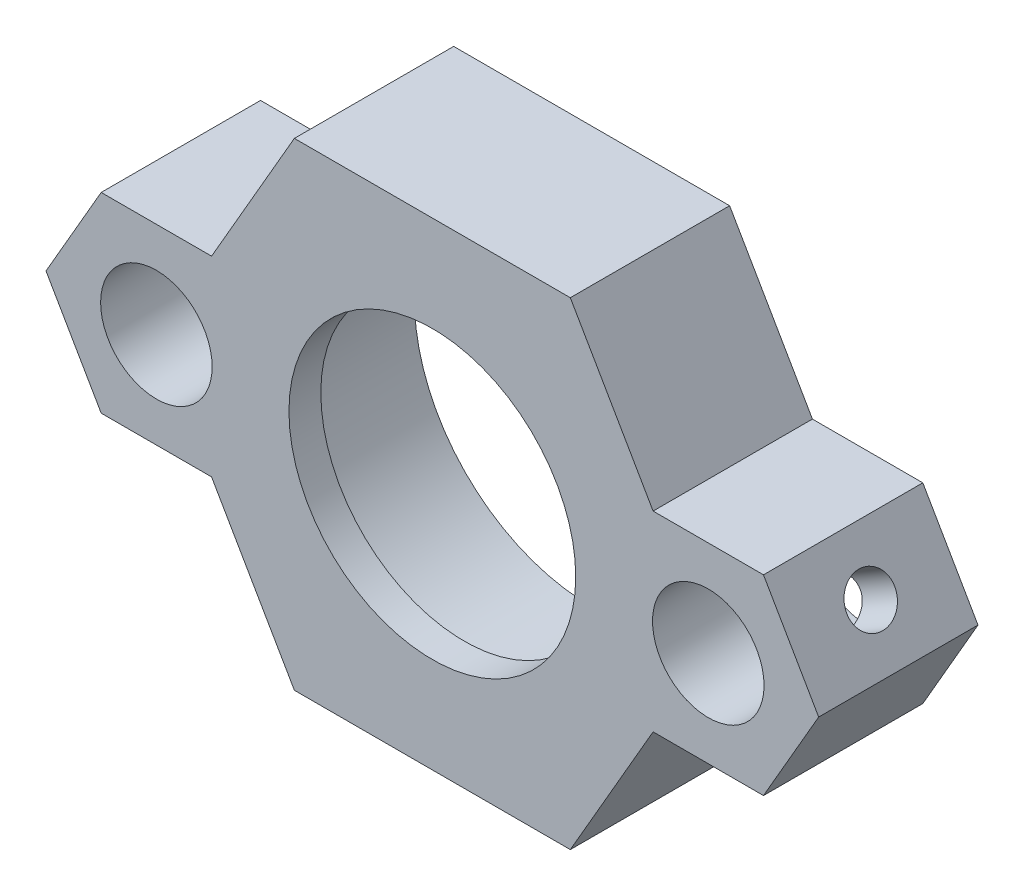
from build123d import *

# Parameters (mm, degrees)
SKETCH3_R               = 11.125
SKETCH3_R_2             = 3.5
BOSS_EXTRUDE1_DEPTH     = 8
SKETCH4_R               = 9
SKETCH4_R_2             = 3.5
BOSS_EXTRUDE3_DEPTH     = 2
CUT_EXTRUDE1_REACH      = 52.507
CUT_EXTRUDE1_END_RADIUS = 3.5
SKETCH5_R               = 1.5
CUT_EXTRUDE2_REACH      = 52.507
CUT_EXTRUDE2_END_RADIUS = 3.5
SKETCH6_R               = 1.5


with BuildPart() as part:
    # Sketch3 → Boss-Extrude1 (new body)
    with BuildSketch(Plane.XY):
        Polygon((8.660254038, 15), (-8.660254038, 15), (-13.856406461, 6), (-20.784609691, 6), (-24.248711306, 0), (-20.784609691, -6), (-13.856406461, -6), (-8.660254038, -15), (8.660254038, -15), (13.856406461, -6), (20.784609691, -6), (24.248711306, 0), (20.784609691, 6), (13.856406461, 6), align=None)
        Circle(SKETCH3_R, mode=Mode.SUBTRACT)
        with Locations((17.320508076, 0)):
            Circle(SKETCH3_R_2, mode=Mode.SUBTRACT)
        with Locations((-17.320508076, 0)):
            Circle(SKETCH3_R_2, mode=Mode.SUBTRACT)
    extrude(amount=BOSS_EXTRUDE1_DEPTH)

    # Sketch4 → Boss-Extrude3 (add)
    with BuildSketch(Plane.XY.offset(8)):
        Polygon((-8.660254038, 15), (-13.856406461, 6), (-20.784609691, 6), (-24.248711306, 0), (-20.784609691, -6), (-13.856406461, -6), (-8.660254038, -15), (8.660254038, -15), (13.856406461, -6), (20.784609691, -6), (24.248711306, 0), (20.784609691, 6), (13.856406461, 6), (8.660254038, 15), align=None)
        Circle(SKETCH4_R, mode=Mode.SUBTRACT)
        with Locations((-17.320508076, 0)):
            Circle(SKETCH4_R_2, mode=Mode.SUBTRACT)
        with Locations((17.320508076, 0)):
            Circle(SKETCH4_R_2, mode=Mode.SUBTRACT)
    extrude(amount=BOSS_EXTRUDE3_DEPTH)

    # Cut-Extrude1: up to this cylinder (the profile starts outside it)
    cut_extrude1_end = Plane(origin=(-17.320508076, 0, 5), z_dir=(0, 0, -1)) * Cylinder(CUT_EXTRUDE1_END_RADIUS, 113.014, mode=Mode.PRIVATE)
    # Sketch5 → Cut-Extrude1 (cut, up to the surface)
    with BuildSketch(Plane(origin=(-18.186533479, 10.5, 0), x_dir=(0, 0, 1), z_dir=(-0.866025403784439, 0.49999999999999944, 0)), mode=Mode.PRIVATE) as cut_extrude1_sk1:
        with Locations((5, -8.660254038)):
            Circle(SKETCH5_R)
    cut_extrude1_tool1 = extrude(cut_extrude1_sk1.sketch, amount=-CUT_EXTRUDE1_REACH, mode=Mode.PRIVATE) - cut_extrude1_end
    add(cut_extrude1_tool1.solids().sort_by_distance((-22.51666, 3, 5))[0], mode=Mode.SUBTRACT)

    # Cut-Extrude2: up to this cylinder (the profile starts outside it)
    cut_extrude2_end = Plane(origin=(17.320508076, 0, 5), z_dir=(0, 0, -1)) * Cylinder(CUT_EXTRUDE2_END_RADIUS, 113.014, mode=Mode.PRIVATE)
    # Sketch6 → Cut-Extrude2 (cut, up to the surface)
    with BuildSketch(Plane(origin=(18.186533479, 10.5, 0), x_dir=(0, 0, -1), z_dir=(0.866025403784439, 0.4999999999999993, 0)), mode=Mode.PRIVATE) as cut_extrude2_sk1:
        with Locations((-5, -8.660254038)):
            Circle(SKETCH6_R)
    cut_extrude2_tool1 = extrude(cut_extrude2_sk1.sketch, amount=-CUT_EXTRUDE2_REACH, mode=Mode.PRIVATE) - cut_extrude2_end
    add(cut_extrude2_tool1.solids().sort_by_distance((22.51666, 3, 5))[0], mode=Mode.SUBTRACT)


solid = part.part
